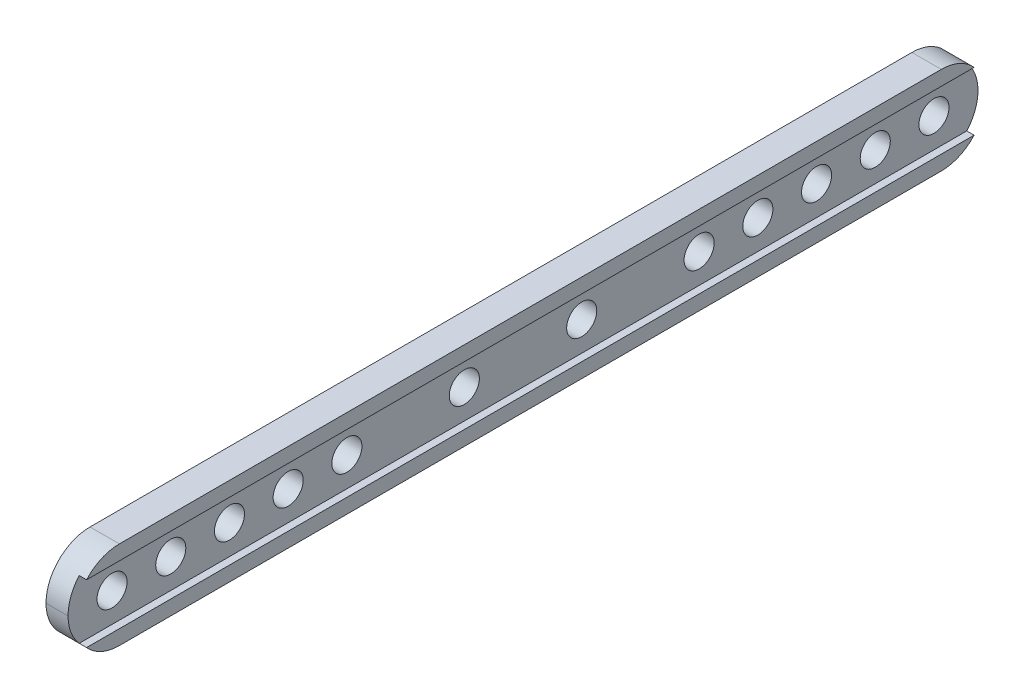
from build123d import *

# Parameters (mm, degrees)
BOSS_EXTRUDE1_DEPTH     = 124
FILLET1_R               = 6
SKETCH2_R               = 2.05
CUT_EXTRUDE1_DEPTH      = 125.643491607
LPATTERN1_COUNT         = 7
LPATTERN1_PITCH         = 8
MIRROR1_COPY_1_SKETCH_R = 2.05
MIRROR1_COPY_1_DEPTH    = 125.643491607
MIRROR1_COPY_2_SKETCH_R = 2.05
MIRROR1_COPY_2_DEPTH    = 125.643491607
MIRROR1_COPY_3_SKETCH_R = 2.05
MIRROR1_COPY_3_DEPTH    = 125.643491607
MIRROR1_COPY_4_SKETCH_R = 2.05
MIRROR1_COPY_4_DEPTH    = 125.643491607
MIRROR1_COPY_5_SKETCH_R = 2.05
MIRROR1_COPY_5_DEPTH    = 125.643491607


with BuildPart() as part:
    # Sketch1 → Boss-Extrude1 (new body)
    with BuildSketch(Plane.XY):
        Polygon((0, 0), (4, 0), (4, 2), (3, 2), (3, 10), (4, 10), (4, 12), (0, 12), align=None)
    extrude(amount=-BOSS_EXTRUDE1_DEPTH)

    # Fillet1
    fillet1_edges = [part.edges().sort_by_distance(p)[0] for p in [
        (2, 12, 0),
        (2, 0, 0),
        (2, 0, -124),
        (2, 12, -124),
    ]]
    fillet(fillet1_edges, radius=FILLET1_R - 0.0001)  # a hair under: the kernel refuses the full size

    # Sketch2 → Cut-Extrude1 (cut, through all)
    with BuildSketch(Plane.ZY):
        with Locations(Location((-118, 6, 0), (0, 0, 270))):
            Circle(SKETCH2_R)
    cut_extrude1 = extrude(amount=-CUT_EXTRUDE1_DEPTH, mode=Mode.SUBTRACT)

    # LPattern1: Cut-Extrude1 ×7, 1 skipped
    with Locations(*[(0, 0, i * LPATTERN1_PITCH) for i in range(1, LPATTERN1_COUNT) if i not in (5,)]):
        add(cut_extrude1, mode=Mode.SUBTRACT)

    # Mirror1: Cut-Extrude1 across plane
    add(cut_extrude1.mirror(Plane.XY.offset(-62)), mode=Mode.SUBTRACT)

    # Mirror1 copy 1 sketch → Mirror1 copy 1 (cut, through all)
    with BuildSketch(Plane(origin=(0, 0, -132), x_dir=(0, 0, -1), z_dir=(-1, 0, 0))):
        with Locations((-118, -6)):
            Circle(MIRROR1_COPY_1_SKETCH_R)
    extrude(amount=-MIRROR1_COPY_1_DEPTH, mode=Mode.SUBTRACT)

    # Mirror1 copy 2 sketch → Mirror1 copy 2 (cut, through all)
    with BuildSketch(Plane(origin=(0, 0, -140), x_dir=(0, 0, -1), z_dir=(-1, 0, 0))):
        with Locations((-118, -6)):
            Circle(MIRROR1_COPY_2_SKETCH_R)
    extrude(amount=-MIRROR1_COPY_2_DEPTH, mode=Mode.SUBTRACT)

    # Mirror1 copy 3 sketch → Mirror1 copy 3 (cut, through all)
    with BuildSketch(Plane(origin=(0, 0, -148), x_dir=(0, 0, -1), z_dir=(-1, 0, 0))):
        with Locations((-118, -6)):
            Circle(MIRROR1_COPY_3_SKETCH_R)
    extrude(amount=-MIRROR1_COPY_3_DEPTH, mode=Mode.SUBTRACT)

    # Mirror1 copy 4 sketch → Mirror1 copy 4 (cut, through all)
    with BuildSketch(Plane(origin=(0, 0, -156), x_dir=(0, 0, -1), z_dir=(-1, 0, 0))):
        with Locations((-118, -6)):
            Circle(MIRROR1_COPY_4_SKETCH_R)
    extrude(amount=-MIRROR1_COPY_4_DEPTH, mode=Mode.SUBTRACT)

    # Mirror1 copy 5 sketch → Mirror1 copy 5 (cut, through all)
    with BuildSketch(Plane(origin=(0, 0, -172), x_dir=(0, 0, -1), z_dir=(-1, 0, 0))):
        with Locations((-118, -6)):
            Circle(MIRROR1_COPY_5_SKETCH_R)
    extrude(amount=-MIRROR1_COPY_5_DEPTH, mode=Mode.SUBTRACT)


solid = part.part
